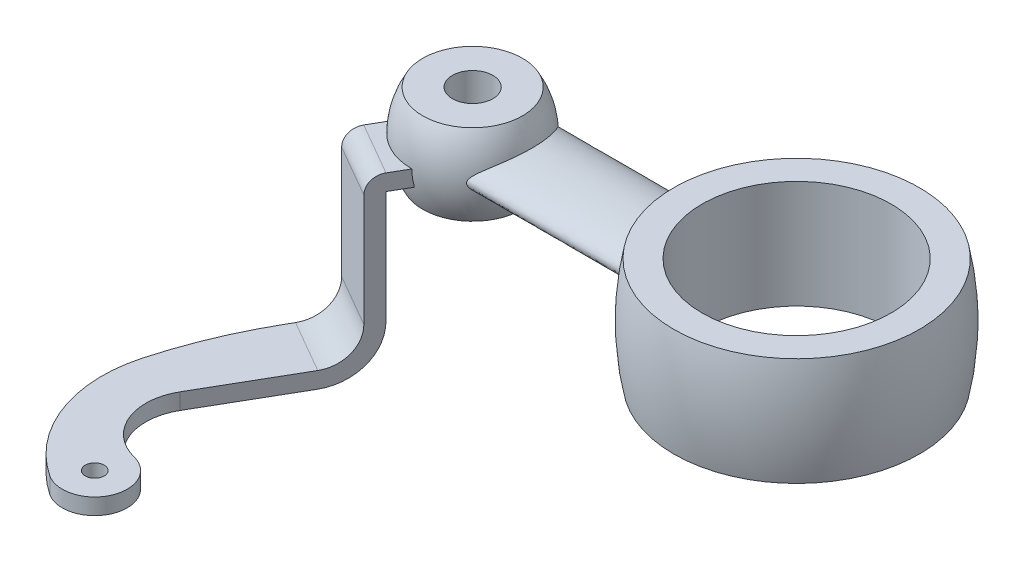
from build123d import *

# Parameters (mm, degrees)
SWEEP_START     = 2.947880486
SWEEP_2_DEPTH   = 12.181381201
EXTRUDE_2_DEPTH = 2.25
SKETCH_10_R     = 0.7
EXTRUDE_1_DEPTH = 1.2


# Read off the part's stored shape, not the designer's step: 扫描2
with BuildPart() as part:
    # 草图2 → 旋转1 (revolve)
    with BuildSketch(Plane.XY, mode=Mode.PRIVATE) as revolve_1_sk:
        with BuildLine():
            Line((-1.5, 3), (-1.5, -3))
            Line((-1.5, -3), (-3.696152423, -3))
            ThreePointArc((-3.696152423, -3), (-4.5, 0), (-3.696152423, 3))
            Line((-3.696152423, 3), (-1.5, 3))
        make_face()
    revolve(revolve_1_sk.sketch.rotate(Axis((0, 9.462237027, 0), (0, -1, 0)), 270), axis=Axis((0, 9.462237027, 0), (0, -1, 0)))



with BuildPart() as body_2:
    # 草图3 → 旋转2 (revolve)
    with BuildSketch(Plane.XY, mode=Mode.PRIVATE) as revolve_2_sk:
        with BuildLine():
            Line((17, 4), (17, -4))
            Line((17, -4), (14.904082058, -4))
            ThreePointArc((14.904082058, -4), (14.5, 0), (14.904082058, 4))
            Line((14.904082058, 4), (17, 4))
        make_face()
    revolve(revolve_2_sk.sketch.rotate(Axis((24, 6.005976882, 0), (0, -1, 0)), 270), axis=Axis((24, 6.005976882, 0), (0, -1, 0)))


with BuildPart() as part_1:
    add(part.part)

    add(body_2.part)  # 扫描2 merges body 2
    # 扫描2 outline → 扫描2 (add)
    with BuildSketch(Plane.YZ.offset(SWEEP_START)):
        with BuildLine():
            add(Edge.make_bspline(
                [(0, -3.4), (2.5, -3.4), (2.5, 3.4), (0, 3.4), (-2.5, 3.4), (-2.5, -3.4), (0, -3.4)],
                knots=[0, 0, 0, 0, 0.5, 0.5, 0.5, 1, 1, 1, 1], degree=3, weights=[1, 0.333333333, 0.333333333, 1, 0.333333333, 0.333333333, 1]))
        make_face()
    extrude(amount=SWEEP_2_DEPTH)

    # 草图9 → 拉伸-薄壁2 (add, symmetric)
    with BuildSketch(Plane(origin=(0, 0, 0), x_dir=(0, 1, 0), z_dir=(-0.8660254037844364, 0, -0.5000000000000041))):
        with BuildLine():
            Line((0, -3.355078601), (0, -5.3))
            ThreePointArc((0, -5.3), (-0.351471863, -6.148528137), (-1.2, -6.5))
            Line((-1.2, -6.5), (-9.5, -6.5))
            ThreePointArc((-9.5, -6.5), (-11.267766953, -7.232233047), (-12, -9))
            Line((-12, -9), (-12, -9.5))
            Line((-12, -9.5), (-13.2, -9.5))
            Line((-13.2, -9.5), (-13.2, -9))
            ThreePointArc((-13.2, -9), (-12.11629509, -6.38370491), (-9.5, -5.3))
            Line((-9.5, -5.3), (-1.2, -5.3))
            Line((-1.2, -5.3), (-1.2, -3.355078601))
            Line((-1.2, -3.355078601), (0, -3.355078601))
        make_face()
    extrude(amount=EXTRUDE_2_DEPTH, both=True)

    # 草图10 → 凸台-拉伸1 (add, through all)
    with BuildSketch(Plane(origin=(0, -12, 0), x_dir=(1, 0, 0), z_dir=(0, 1, 0))):
        with BuildLine():
            ThreePointArc((-6.286157602, -15.387944351), (-6.507210887, -18.943461425), (-3.80534528, -21.265203972))
            ThreePointArc((-3.80534528, -21.265203972), (-2.199315933, -24.567043542), (-5.723870365, -25.596116359))
            ThreePointArc((-5.723870365, -25.596116359), (-9.561667453, -20.76886571), (-9.837809191, -14.60812054))
            ThreePointArc((-9.837809191, -14.60812054), (-8.507698539, -10.755006252), (-6.698557159, -7.102241336))
            Line((-6.698557159, -7.102241336), (-2.801442841, -9.352241336))
            Line((-2.801442841, -9.352241336), (-6.286157602, -15.387944351))
        make_face()
        with Locations(Location((-4.395932047, -23.593977652, 0), (0, 0, 180))):
            Circle(SKETCH_10_R, mode=Mode.SUBTRACT)
    extrude(amount=-EXTRUDE_1_DEPTH)


solid = part_1.part
